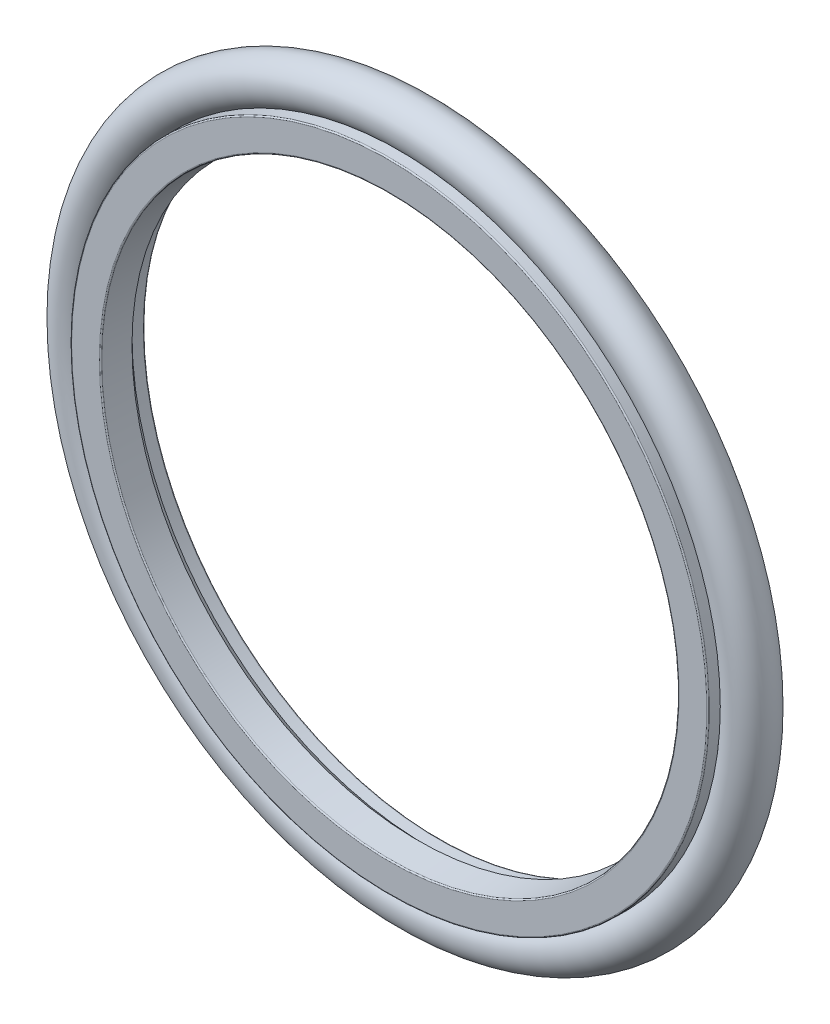
from build123d import *

# Parameters (mm, degrees)
SKETCH4_R = 1.765


with BuildPart() as part:
    # Sketch1 → Revolve1 (revolve)
    with BuildSketch(Plane(origin=(0, 0, 0), x_dir=(0, 0, -1), z_dir=(1, 0, 0))):
        with BuildLine():
            Line((0, 23.55), (0, 25.25))
            ThreePointArc((0, 25.25), (-0.029289322, 25.320710678), (-0.1, 25.35))
            Line((-0.1, 25.35), (-3.9, 25.35))
            ThreePointArc((-3.9, 25.35), (-3.970710678, 25.320710678), (-4, 25.25))
            Line((-4, 25.25), (-4, 23.041681708))
            ThreePointArc((-4, 23.041681708), (-3.973709891, 22.974103221), (-3.908662962, 22.942057649))
            Line((-3.908662962, 22.942057649), (-1.7, 22.75))
            Line((-1.7, 22.75), (-1, 23.45))
            Line((-1, 23.45), (-0.1, 23.45))
            ThreePointArc((-0.1, 23.45), (-0.029289322, 23.479289322), (0, 23.55))
        make_face()
    revolve(axis=Axis((0, 0, 0), (0, 0, 1)))


with BuildPart() as body_2:
    # Sketch4 → Revolve2 (revolve)
    with BuildSketch(Plane(origin=(0, 0, 0), x_dir=(0, 0, -1), z_dir=(1, 0, 0))):
        with Locations((-1.95, 26.765)):
            Circle(SKETCH4_R)
    revolve(axis=Axis((0, 0, 0), (0, 0, 1)))


solid = Compound([part.part, body_2.part])
